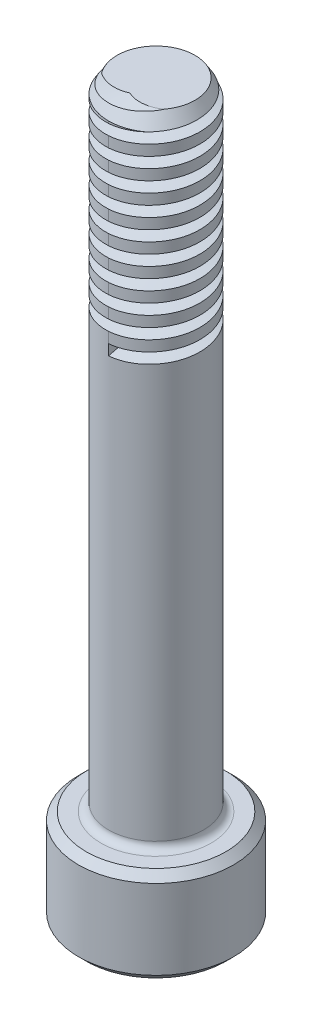
from build123d import *

# Parameters (mm, degrees)
CUT_SWEEP1_PITCH   = 0.635
CUT_EXTRUDE1_DEPTH = 1.2954
FILLET1_R          = 0.2286
FILLET2_R          = 0.396875794
CHAMFER2_SIZE      = 0.2286
CHAMFER3_SIZE      = 0.127


with BuildPart() as part:
    # Sketch1 → Revolve1 (revolve)
    with BuildSketch(Plane.XY, mode=Mode.PRIVATE) as revolve1_sk:
        Polygon((0, 0), (0, 21.8948), (1.4224, 21.8948), (1.4224, 2.8448), (2.3241, 2.8448), (2.3241, 0), align=None)
    revolve(revolve1_sk.sketch.rotate(Axis((0, 0, 0), (0, 1, 0)), 90), axis=Axis((0, 0, 0), (0, 1, 0)))

    # Cut-Sweep1: arcs per turn and ends read off the stored shape
    # Cut-Sweep1: the profile of Sketch3 profile screwed along a right-hand helix through 11 turns, 6 arcs to a turn; built about Z, then put on its axis
    cut_sweep1_z = Axis((0, 0, 0), (0, 0, 1))
    cut_sweep1_corners = [(1.4227, 0, -0.476175), (1.4227, 0, -0.793825), (0.78739873, 0, -0.635)]
    with BuildLine(mode=Mode.PRIVATE) as cut_sweep1_profile:
        Line(cut_sweep1_corners[0], cut_sweep1_corners[1])
        Line(cut_sweep1_corners[1], cut_sweep1_corners[2])
        Line(cut_sweep1_corners[2], cut_sweep1_corners[0])
    cut_sweep1_cap = Face(cut_sweep1_profile.wire())
    cut_sweep1_turn_angles = [0, 30, 60, 90, 120, 150, 180, 210, 240, 270, 300, 330, 360]
    cut_sweep1_turn_weights = [1, 0.8660254037844387, 1, 0.8660254037844387, 1, 0.8660254037844387, 1, 0.8660254037844387, 1, 0.8660254037844387, 1, 0.8660254037844387, 1]
    cut_sweep1_turn_rails = [Edge.make_bspline([Vector(p[0], p[1], 0).rotate(cut_sweep1_z, cut_sweep1_turn_angles[k]) / cut_sweep1_turn_weights[k] + Vector(0, 0, p[2] + CUT_SWEEP1_PITCH * cut_sweep1_turn_angles[k] / 360) for k in range(13)], [0, 0, 0, 1, 1, 2, 2, 3, 3, 4, 4, 5, 5, 6, 6, 6], 2, cut_sweep1_turn_weights) for p in cut_sweep1_corners]
    cut_sweep1_turn_sides = [Face.make_surface_from_curves(cut_sweep1_turn_rails[p[0]], cut_sweep1_turn_rails[p[1]]) for p in [(0, 1), (1, 2), (2, 0)]]
    cut_sweep1 = Plane(origin=(0, 21.8948, 0), x_dir=(0, 0, 1), z_dir=(0, -1, 0)) * Solid(Shell([*[p.moved(Location((0, 0, CUT_SWEEP1_PITCH * i))) for i in range(11) for p in cut_sweep1_turn_sides], cut_sweep1_cap, cut_sweep1_cap.rotate(cut_sweep1_z, 3960).moved(Location((0, 0, CUT_SWEEP1_PITCH * 3960 / 360)))]))
    add(cut_sweep1, mode=Mode.SUBTRACT)

    # Sketch4 → Cut-Extrude1 (cut)
    with BuildSketch(Plane(origin=(0, 0, 0), x_dir=(1, 0, 0), z_dir=(0, 1, 0))):
        Polygon((0, 1.378481503), (-1.1938, 0.689240751), (-1.1938, -0.689240751), (0, -1.378481503), (1.1938, -0.689240751), (1.1938, 0.689240751), align=None)
    extrude(amount=CUT_EXTRUDE1_DEPTH, mode=Mode.SUBTRACT)

    # Fillet1
    fillet1_edges = [part.edges().sort_by_distance(p)[0] for p in [
        (0, 2.8448, 1.4224),
    ]]
    fillet(fillet1_edges, radius=FILLET1_R)

    # Fillet2
    fillet2_edges = [part.edges().sort_by_distance(p)[0] for p in [
        (1.1938, 0.6477, -0.689240751),
        (0, 0.6477, -1.378481503),
        (-1.1938, 0.6477, -0.689240751),
        (-1.1938, 0.6477, 0.689240751),
        (0, 0.6477, 1.378481503),
        (1.1938, 0.6477, 0.689240751),
        (0.5969, 1.2954, -1.033861127),
        (-0.5969, 1.2954, -1.033861127),
        (-1.1938, 1.2954, 0),
        (-0.5969, 1.2954, 1.033861127),
        (0.5969, 1.2954, 1.033861127),
        (1.1938, 1.2954, 0),
    ]]
    fillet(fillet2_edges, radius=FILLET2_R)

    # Chamfer1: read off the stored shape, not the designer's step
    # Chamfer1 outline → Chamfer1 (revolve, cut)
    with BuildSketch(Plane.XY):
        Polygon((1.4224, 21.8948), (1.168399492, 21.8948), (1.4224, 21.483376279), align=None)
    revolve(axis=Axis((0, 0, 0), (0, 1, 0)), mode=Mode.SUBTRACT)

    # Chamfer2
    chamfer2_edges = [part.edges().sort_by_distance(p)[0] for p in [
        (0, 0, 2.3241),
        (0, 2.8448, 2.3241),
    ]]
    chamfer(chamfer2_edges, length=CHAMFER2_SIZE)

    # Chamfer3
    chamfer3_edges = [part.edges().sort_by_distance(p)[0] for p in [
        (0.5969, 0, -1.033861127),
        (-0.5969, 0, -1.033861127),
        (-1.1938, 0, 0),
        (-0.5969, 0, 1.033861127),
        (0.5969, 0, 1.033861127),
        (1.1938, 0, 0),
        (0, 0, -1.317084604),
        (1.140628726, 0, -0.658542302),
        (1.140628726, 0, 0.658542302),
        (0, 0, 1.317084604),
        (-1.140628726, 0, 0.658542302),
        (-1.140628726, 0, -0.658542302),
    ]]
    chamfer(chamfer3_edges, length=CHAMFER3_SIZE)


solid = part.part
